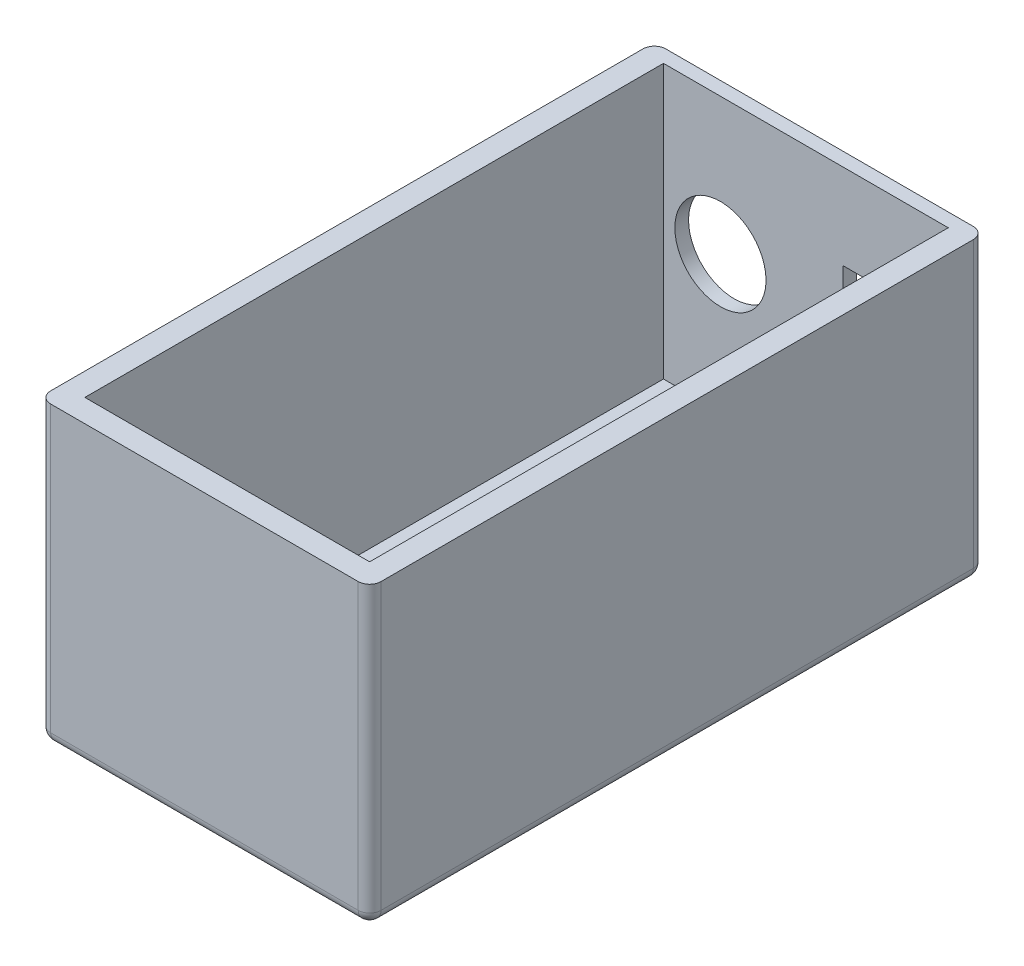
from build123d import *

# Parameters (mm, degrees)
SKETCH1_W           = 29
SKETCH1_H           = 54
SKETCH1_W_2         = 25
SKETCH1_H_2         = 50
BOSS_EXTRUDE1_DEPTH = 24
SKETCH2_W           = 29
SKETCH2_H           = 54
BOSS_EXTRUDE2_DEPTH = 2
CUT_EXTRUDE1_REACH  = 62.846
SKETCH3_R           = 4
SKETCH3_W           = 3.5
SKETCH3_H           = 9
SKETCH6_W           = 25
SKETCH6_H           = 24
CUT_EXTRUDE4_DEPTH  = 0.8
FILLET1_R           = 1


with BuildPart() as part:
    # Sketch1 → Boss-Extrude1 (new body)
    with BuildSketch(Plane(origin=(0, 0, 0), x_dir=(1, 0, 0), z_dir=(0, 1, 0))):
        Rectangle(SKETCH1_W, SKETCH1_H)
        Rectangle(SKETCH1_W_2, SKETCH1_H_2, mode=Mode.SUBTRACT)
    extrude(amount=BOSS_EXTRUDE1_DEPTH)

    # Sketch2 → Boss-Extrude2 (add)
    with BuildSketch(Plane.XZ):
        Rectangle(SKETCH2_W, SKETCH2_H)
    extrude(amount=BOSS_EXTRUDE2_DEPTH)

    # Sketch3 → Cut-Extrude1 (cut, up to next)
    with BuildSketch(Plane(origin=(0, 0, -27), x_dir=(-1, 0, 0), z_dir=(0, 0, -1)), mode=Mode.PRIVATE) as cut_extrude1_sk1:
        with Locations((7.5, 12)):
            Circle(SKETCH3_R)
    cut_extrude1_tool1 = extrude(cut_extrude1_sk1.sketch, amount=-CUT_EXTRUDE1_REACH, mode=Mode.PRIVATE) & part.part
    # Sketch3 → Cut-Extrude1 (cut, up to next)
    with BuildSketch(Plane(origin=(0, 0, -27), x_dir=(-1, 0, 0), z_dir=(0, 0, -1)), mode=Mode.PRIVATE) as cut_extrude1_sk2:
        with Locations((-5, 12)):
            Rectangle(SKETCH3_W, SKETCH3_H)
    cut_extrude1_tool2 = extrude(cut_extrude1_sk2.sketch, amount=-CUT_EXTRUDE1_REACH, mode=Mode.PRIVATE) & part.part
    add(cut_extrude1_tool1.solids().sort_by_distance((-7.5, 12, -27))[0], mode=Mode.SUBTRACT)
    add(cut_extrude1_tool2.solids().sort_by_distance((5, 12, -27))[0], mode=Mode.SUBTRACT)

    # Sketch6 → Cut-Extrude4 (cut)
    with BuildSketch(Plane.XY.offset(-25)):
        with Locations((0, 12)):
            Rectangle(SKETCH6_W, SKETCH6_H)
    extrude(amount=-CUT_EXTRUDE4_DEPTH, mode=Mode.SUBTRACT)

    # Fillet1
    fillet1_edges = [part.edges().sort_by_distance(p)[0] for p in [
        (0, -2, -27),
        (-14.5, -2, 0),
        (0, -2, 27),
        (14.5, -2, 0),
        (14.5, 11, 27),
        (-14.5, 11, 27),
        (-14.5, 11, -27),
        (14.5, 11, -27),
    ]]
    fillet(fillet1_edges, radius=FILLET1_R)


solid = part.part
